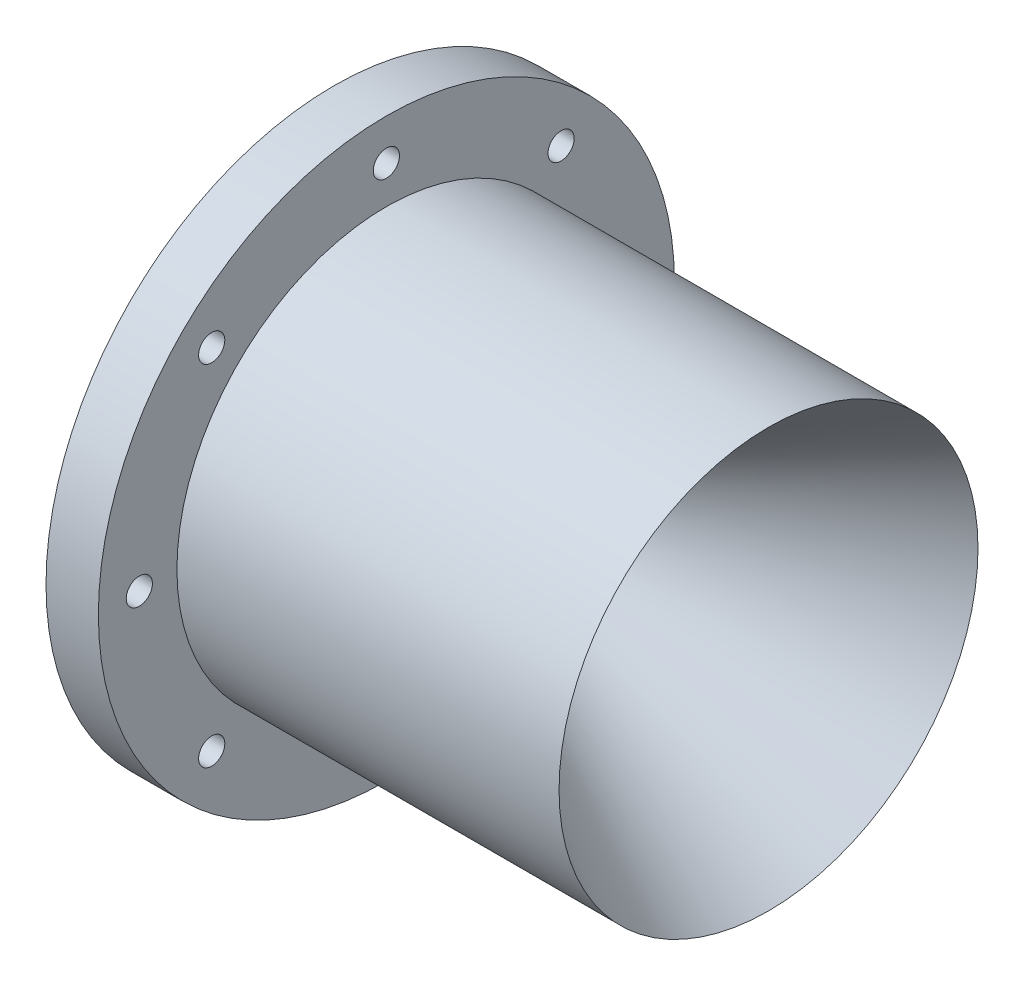
from build123d import *

# Parameters (mm, degrees)
SKETCH2_R          = 49.53
SKETCH2_R_2        = 47.625
CUT_EXTRUDE1_DEPTH = 1.1176
CUT_EXTRUDE2_REACH = 146.434
SKETCH3_R          = 3.175


with BuildPart() as part:
    # Sketch1 → Revolve1 (revolve)
    with BuildSketch(Plane.XY):
        Polygon((0, 7.9375), (72.324156056, 50.8), (-20.347266862, 50.8), (-20.347266862, 69.85), (-33.047266862, 69.85), (-33.047266862, 50.8), (-33.047266862, 41.275), (-12.7, 7.9375), align=None)
    revolve(axis=Axis((0, 0, 0), (1, 0, 0)))

    # Sketch2 → Cut-Extrude1 (cut)
    with BuildSketch(Plane.ZY.offset(33.047266862)):
        Circle(SKETCH2_R)
        Circle(SKETCH2_R_2, mode=Mode.SUBTRACT)
    extrude(amount=-CUT_EXTRUDE1_DEPTH, mode=Mode.SUBTRACT)

    # Sketch3 → Cut-Extrude2 (cut, up to next)
    with BuildSketch(Plane.ZY.offset(33.047266862), mode=Mode.PRIVATE) as cut_extrude2_sk1:
        with Locations((0, 59.9186)):
            Circle(SKETCH3_R)
    cut_extrude2_tool1 = extrude(cut_extrude2_sk1.sketch, amount=-CUT_EXTRUDE2_REACH, mode=Mode.PRIVATE) & part.part
    # Sketch3 → Cut-Extrude2 (cut, up to next)
    with BuildSketch(Plane.ZY.offset(33.047266862), mode=Mode.PRIVATE) as cut_extrude2_sk2:
        with Locations((42.368848379, 42.368848379)):
            Circle(SKETCH3_R)
    cut_extrude2_tool2 = extrude(cut_extrude2_sk2.sketch, amount=-CUT_EXTRUDE2_REACH, mode=Mode.PRIVATE) & part.part
    # Sketch3 → Cut-Extrude2 (cut, up to next)
    with BuildSketch(Plane.ZY.offset(33.047266862), mode=Mode.PRIVATE) as cut_extrude2_sk3:
        with Locations((59.9186, 0)):
            Circle(SKETCH3_R)
    cut_extrude2_tool3 = extrude(cut_extrude2_sk3.sketch, amount=-CUT_EXTRUDE2_REACH, mode=Mode.PRIVATE) & part.part
    # Sketch3 → Cut-Extrude2 (cut, up to next)
    with BuildSketch(Plane.ZY.offset(33.047266862), mode=Mode.PRIVATE) as cut_extrude2_sk4:
        with Locations((42.368848379, -42.368848379)):
            Circle(SKETCH3_R)
    cut_extrude2_tool4 = extrude(cut_extrude2_sk4.sketch, amount=-CUT_EXTRUDE2_REACH, mode=Mode.PRIVATE) & part.part
    # Sketch3 → Cut-Extrude2 (cut, up to next)
    with BuildSketch(Plane.ZY.offset(33.047266862), mode=Mode.PRIVATE) as cut_extrude2_sk5:
        with Locations((0, -59.9186)):
            Circle(SKETCH3_R)
    cut_extrude2_tool5 = extrude(cut_extrude2_sk5.sketch, amount=-CUT_EXTRUDE2_REACH, mode=Mode.PRIVATE) & part.part
    # Sketch3 → Cut-Extrude2 (cut, up to next)
    with BuildSketch(Plane.ZY.offset(33.047266862), mode=Mode.PRIVATE) as cut_extrude2_sk6:
        with Locations((-42.368848379, -42.368848379)):
            Circle(SKETCH3_R)
    cut_extrude2_tool6 = extrude(cut_extrude2_sk6.sketch, amount=-CUT_EXTRUDE2_REACH, mode=Mode.PRIVATE) & part.part
    # Sketch3 → Cut-Extrude2 (cut, up to next)
    with BuildSketch(Plane.ZY.offset(33.047266862), mode=Mode.PRIVATE) as cut_extrude2_sk7:
        with Locations((-59.9186, 0)):
            Circle(SKETCH3_R)
    cut_extrude2_tool7 = extrude(cut_extrude2_sk7.sketch, amount=-CUT_EXTRUDE2_REACH, mode=Mode.PRIVATE) & part.part
    # Sketch3 → Cut-Extrude2 (cut, up to next)
    with BuildSketch(Plane.ZY.offset(33.047266862), mode=Mode.PRIVATE) as cut_extrude2_sk8:
        with Locations((-42.368848379, 42.368848379)):
            Circle(SKETCH3_R)
    cut_extrude2_tool8 = extrude(cut_extrude2_sk8.sketch, amount=-CUT_EXTRUDE2_REACH, mode=Mode.PRIVATE) & part.part
    add(cut_extrude2_tool1.solids().sort_by_distance((-33.047267, 59.9186, 0))[0], mode=Mode.SUBTRACT)
    add(cut_extrude2_tool2.solids().sort_by_distance((-33.047267, 42.368848, 42.368848))[0], mode=Mode.SUBTRACT)
    add(cut_extrude2_tool3.solids().sort_by_distance((-33.047267, 0, 59.9186))[0], mode=Mode.SUBTRACT)
    add(cut_extrude2_tool4.solids().sort_by_distance((-33.047267, -42.368848, 42.368848))[0], mode=Mode.SUBTRACT)
    add(cut_extrude2_tool5.solids().sort_by_distance((-33.047267, -59.9186, 0))[0], mode=Mode.SUBTRACT)
    add(cut_extrude2_tool6.solids().sort_by_distance((-33.047267, -42.368848, -42.368848))[0], mode=Mode.SUBTRACT)
    add(cut_extrude2_tool7.solids().sort_by_distance((-33.047267, 0, -59.9186))[0], mode=Mode.SUBTRACT)
    add(cut_extrude2_tool8.solids().sort_by_distance((-33.047267, 42.368848, -42.368848))[0], mode=Mode.SUBTRACT)


solid = part.part
